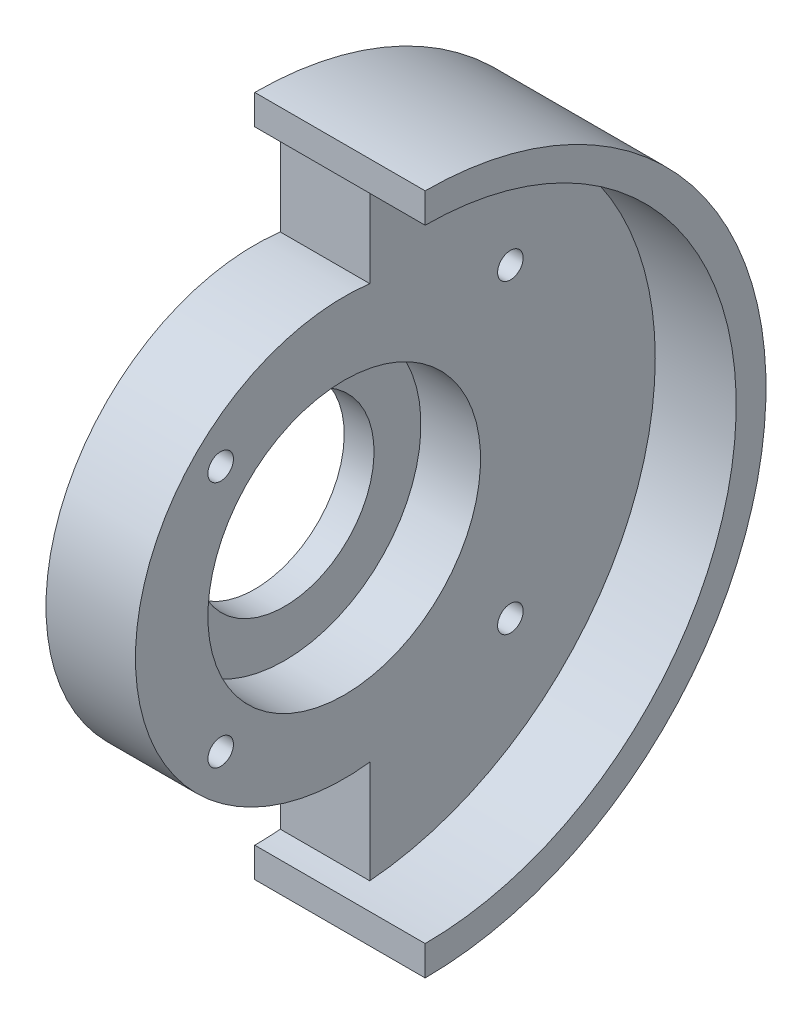
from build123d import *
from build123d.topology import SkipClean

# Parameters (mm, degrees)
CUT_EXTRUDE1_DEPTH      = 58.534772095
CUT_EXTRUDE1_DEPTH_BACK = 58.534772095
SKETCH2_R               = 1.5
SKETCH3_R               = 2.75
CUT_EXTRUDE2_DEPTH      = 5


with BuildPart() as part:
    # Sketch1 → Revolve1 (revolve)
    with BuildSketch(Plane.XY):
        Polygon((20, 40), (20, 36.5), (10.5, 36.5), (10.5, 16), (3.5, 16), (3.5, 10.5), (0, 10.5), (0, 40), align=None)
    revolve(axis=Axis((20, 0, 0), (-1, 0, 0)))

    # Sketch2 → Cut-Extrude1 (cut, two sides: drawn at the far end of the back side and taken through both)
    with SkipClean():  # the faces are left unmerged after this step: merging them gives an invalid solid
        with BuildSketch(Plane(origin=(10.5, 0, 0), x_dir=(0, 0, -1), z_dir=(1, 0, 0)).offset(-CUT_EXTRUDE1_DEPTH_BACK)):
            with Locations((-14.495689014, 14.495689014)):
                Circle(SKETCH2_R)
            with Locations((19.5, -17.944358445)):
                Circle(SKETCH2_R)
            with Locations((19.5, 17.944358445)):
                Circle(SKETCH2_R)
            with Locations((-14.495689014, -14.495689014)):
                Circle(SKETCH2_R)
            with BuildLine():
                Line((3, 24.315632832), (3, 36.376503405))
                ThreePointArc((3, 36.376503405), (1.501270413, 36.469112783), (0, 36.5))
                Line((0, 36.5), (0, 40))
                ThreePointArc((0, 40), (-40, 0), (0, -40))
                Line((0, -40), (0, -36.5))
                ThreePointArc((0, -36.5), (1.501270413, -36.469112783), (3, -36.376503405))
                Line((3, -36.376503405), (3, -24.315632832))
                ThreePointArc((3, -24.315632832), (-24.5, 0), (3, 24.315632832))
            make_face()
        extrude(amount=CUT_EXTRUDE1_DEPTH + CUT_EXTRUDE1_DEPTH_BACK, mode=Mode.SUBTRACT)

    # Sketch3 → Cut-Extrude2 (cut)
    with SkipClean():  # the faces are left unmerged after this step: merging them gives an invalid solid
        with BuildSketch(Plane.ZY):
            with Locations((-19.5, 17.944358445)):
                Circle(SKETCH3_R)
            with Locations((14.495689014, 14.495689014)):
                Circle(SKETCH3_R)
            with Locations((-19.5, -17.944358445)):
                Circle(SKETCH3_R)
            with Locations((14.495689014, -14.495689014)):
                Circle(SKETCH3_R)
        extrude(amount=-CUT_EXTRUDE2_DEPTH, mode=Mode.SUBTRACT)


solid = part.part
